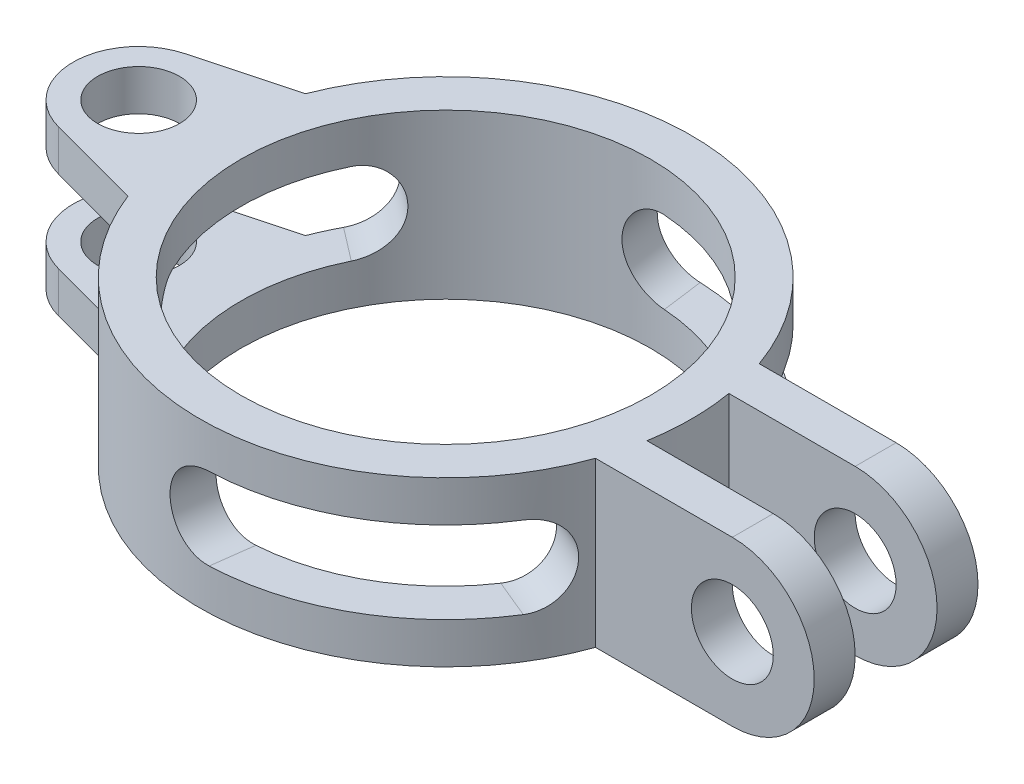
from build123d import *

# Parameters (mm, degrees)
SKETCH1_R           = 30
SKETCH1_R_2         = 25
BOSS_EXTRUDE1_DEPTH = 10
SKETCH3_R           = 5
BOSS_EXTRUDE2_DEPTH = 5
BOSS_EXTRUDE3_DEPTH = 20
CUT_EXTRUDE1_DEPTH  = 5
CUT_EXTRUDE2_REACH  = 70.739
FILLET1_R           = 5
FILLET2_R           = 5
FILLET3_R           = 5
FILLET4_R           = 5
FILLET5_R           = 5
FILLET6_R           = 5


# Some blends are built 0.0001 mm under size
with BuildPart() as part:
    # Sketch1 → Boss-Extrude1 (new, symmetric)
    with BuildSketch(Plane(origin=(0, 0, 0), x_dir=(1, 0, 0), z_dir=(0, 1, 0))):
        with Locations(Location((0, 0, 0), (0, 0, 270))):
            Circle(SKETCH1_R)
        with Locations(Location((0, 0, 0), (0, 0, 270))):
            Circle(SKETCH1_R_2, mode=Mode.SUBTRACT)
    extrude(amount=BOSS_EXTRUDE1_DEPTH, both=True)

    # Sketch3 → Boss-Extrude2 (add)
    with BuildSketch(Plane(origin=(0, 10, 0), x_dir=(1, 0, 0), z_dir=(0, 1, 0))):
        with BuildLine():
            Line((-27.975291142, 10.83434749), (-39.570552361, 7.72740661))
            ThreePointArc((-39.570552361, 7.72740661), (-45.5, 0), (-39.570552361, -7.72740661))
            Line((-39.570552361, -7.72740661), (-27.975291142, -10.83434749))
            ThreePointArc((-27.975291142, -10.83434749), (-30, 0), (-27.975291142, 10.83434749))
        make_face()
        with Locations(Location((-37.5, 0, 0), (0, 0, 270))):
            Circle(SKETCH3_R, mode=Mode.SUBTRACT)
    boss_extrude2 = extrude(amount=-BOSS_EXTRUDE2_DEPTH)

    # Sketch3<3> → Boss-Extrude3 (add)
    with BuildSketch(Plane(origin=(0, 10, 0), x_dir=(1, 0, 0), z_dir=(0, 1, 0))):
        with BuildLine():
            Line((55, 10), (28.284271247, 10))
            ThreePointArc((28.284271247, 10), (29.040144856, 7.527947046), (29.580398915, 5))
            Line((29.580398915, 5), (55, 5))
            Line((55, 5), (55, 10))
        make_face()
        with BuildLine():
            ThreePointArc((29.580398915, -5), (29.040144856, -7.527947046), (28.284271247, -10))
            Line((28.284271247, -10), (55, -10))
            Line((55, -10), (55, -5))
            Line((55, -5), (29.580398915, -5))
        make_face()
    extrude(amount=-BOSS_EXTRUDE3_DEPTH)

    # Mirror1: Boss-Extrude2 across plane
    add(boss_extrude2.mirror(Plane.ZX))

    # Sketch4 → Cut-Extrude1 (cut, symmetric)
    with BuildSketch(Plane(origin=(0, 0, 0), x_dir=(1, 0, 0), z_dir=(0, 1, 0))):
        with BuildLine():
            ThreePointArc((-19.833833507, 15.219035725), (-25, 0), (-19.833833507, -15.219035725))
            Line((-19.833833507, -15.219035725), (-23.800600209, -18.26284287))
            ThreePointArc((-23.800600209, -18.26284287), (-30, 0), (-23.800600209, 18.26284287))
            Line((-23.800600209, 18.26284287), (-19.833833507, 15.219035725))
        make_face()
        with BuildLine():
            Line((23.096988313, -9.567085809), (27.716385975, -11.480502971))
            ThreePointArc((27.716385975, -11.480502971), (15, -25.980762114), (-3.915785767, -29.743345841))
            Line((-3.915785767, -29.743345841), (-3.263154806, -24.786121534))
            ThreePointArc((-3.263154806, -24.786121534), (12.5, -21.650635095), (23.096988313, -9.567085809))
        make_face()
        with BuildLine():
            Line((-3.263154806, 24.786121534), (-3.915785767, 29.743345841))
            ThreePointArc((-3.915785767, 29.743345841), (15, 25.980762114), (27.716385975, 11.480502971))
            Line((27.716385975, 11.480502971), (23.096988313, 9.567085809))
            ThreePointArc((23.096988313, 9.567085809), (12.5, 21.650635095), (-3.263154806, 24.786121534))
        make_face()
    extrude(amount=CUT_EXTRUDE1_DEPTH, both=True, mode=Mode.SUBTRACT)

    # Cut-Extrude2: up to this face of the body (flat: up to its plane)
    cut_extrude2_end = Plane(part.part.faces().sort_by_distance((41.642135624, 0, -10))[0])
    # Sketch5 → Cut-Extrude2 (cut, up to the picked face)
    with BuildSketch(Plane.XY.offset(10), mode=Mode.PRIVATE) as cut_extrude2_sk1:
        with BuildLine():
            ThreePointArc((45, 10), (52.071067812, 7.071067812), (55, 0))
            Line((55, 0), (55, 10))
            Line((55, 10), (45, 10))
        make_face()
    cut_extrude2_tool1 = split(extrude(cut_extrude2_sk1.sketch, amount=-CUT_EXTRUDE2_REACH, mode=Mode.PRIVATE), bisect_by=cut_extrude2_end, keep=Keep.BOTH, mode=Mode.PRIVATE)
    # Sketch5 → Cut-Extrude2 (cut, up to the picked face)
    with BuildSketch(Plane.XY.offset(10), mode=Mode.PRIVATE) as cut_extrude2_sk2:
        with BuildLine():
            Line((55, -10), (55, 0))
            ThreePointArc((55, 0), (52.071067812, -7.071067812), (45, -10))
            Line((45, -10), (55, -10))
        make_face()
    cut_extrude2_tool2 = split(extrude(cut_extrude2_sk2.sketch, amount=-CUT_EXTRUDE2_REACH, mode=Mode.PRIVATE), bisect_by=cut_extrude2_end, keep=Keep.BOTH, mode=Mode.PRIVATE)
    # Sketch5 → Cut-Extrude2 (cut, up to the picked face)
    with BuildSketch(Plane.XY.offset(10), mode=Mode.PRIVATE) as cut_extrude2_sk3:
        with BuildLine():
            ThreePointArc((40, 0), (45, -5), (50, 0))
            Line((50, 0), (40, 0))
        make_face()
    cut_extrude2_tool3 = split(extrude(cut_extrude2_sk3.sketch, amount=-CUT_EXTRUDE2_REACH, mode=Mode.PRIVATE), bisect_by=cut_extrude2_end, keep=Keep.BOTH, mode=Mode.PRIVATE)
    # Sketch5 → Cut-Extrude2 (cut, up to the picked face)
    with BuildSketch(Plane.XY.offset(10), mode=Mode.PRIVATE) as cut_extrude2_sk4:
        with BuildLine():
            Line((40, 0), (50, 0))
            ThreePointArc((50, 0), (45, 5), (40, 0))
        make_face()
    cut_extrude2_tool4 = split(extrude(cut_extrude2_sk4.sketch, amount=-CUT_EXTRUDE2_REACH, mode=Mode.PRIVATE), bisect_by=cut_extrude2_end, keep=Keep.BOTH, mode=Mode.PRIVATE)
    # Sketch5 → Cut-Extrude2 (cut, up to the picked face)
    with BuildSketch(Plane.XY.offset(10), mode=Mode.PRIVATE) as cut_extrude2_sk5:
        with BuildLine():
            ThreePointArc((40, 0), (45, -5), (50, 0))
            Line((50, 0), (40, 0))
        make_face()
    cut_extrude2_tool5 = split(extrude(cut_extrude2_sk5.sketch, amount=-CUT_EXTRUDE2_REACH, mode=Mode.PRIVATE), bisect_by=cut_extrude2_end, keep=Keep.BOTH, mode=Mode.PRIVATE)
    # Sketch5 → Cut-Extrude2 (cut, up to the picked face)
    with BuildSketch(Plane.XY.offset(10), mode=Mode.PRIVATE) as cut_extrude2_sk6:
        with BuildLine():
            Line((40, 0), (50, 0))
            ThreePointArc((50, 0), (45, 5), (40, 0))
        make_face()
    cut_extrude2_tool6 = split(extrude(cut_extrude2_sk6.sketch, amount=-CUT_EXTRUDE2_REACH, mode=Mode.PRIVATE), bisect_by=cut_extrude2_end, keep=Keep.BOTH, mode=Mode.PRIVATE)
    add(cut_extrude2_tool1.solids().sort_by(Axis((52.766321, 7.766321, 10), (0, 0, -1)))[0], mode=Mode.SUBTRACT)
    add(cut_extrude2_tool2.solids().sort_by(Axis((52.766321, -7.766321, 10), (0, 0, -1)))[0], mode=Mode.SUBTRACT)
    add(cut_extrude2_tool3.solids().sort_by(Axis((45, -2.122066, 10), (0, 0, -1)))[0], mode=Mode.SUBTRACT)
    add(cut_extrude2_tool4.solids().sort_by(Axis((45, 2.122066, 10), (0, 0, -1)))[0], mode=Mode.SUBTRACT)
    add(cut_extrude2_tool5.solids().sort_by(Axis((45, -2.122066, 10), (0, 0, -1)))[0], mode=Mode.SUBTRACT)
    add(cut_extrude2_tool6.solids().sort_by(Axis((45, 2.122066, 10), (0, 0, -1)))[0], mode=Mode.SUBTRACT)

    # Fillet1
    # the kernel refuses this fillet: 5 mm, written as the material it adds along each edge
    with BuildSketch(Plane(origin=(-5.547363169, -5, 42.136406608), x_dir=(0, 1, 0), z_dir=(0.13052619222004758, 0, -0.9914448613738109))) as fillet1_piece_1_section:
        with BuildLine():
            CenterArc((FILLET1_R, FILLET1_R), FILLET1_R, 180, 90)
            Line((0, FILLET1_R), (0, 0))
            Line((0, 0), (FILLET1_R, 0))
        make_face()
    fillet1_piece_1 = extrude(amount=30, mode=Mode.PRIVATE)
    fillet1_piece_1 = fillet1_piece_1 - Plane(origin=(0, -3.86938401, 0), x_dir=(0, 0, 1), z_dir=(0, -1, 0)) * Cylinder(25, 80, mode=Mode.PRIVATE)
    fillet1_piece_1 = fillet1_piece_1 & Plane(origin=(0, -3.86938401, 0), x_dir=(0, 0, 1), z_dir=(0, 1, 0)) * Cylinder(30, 80, mode=Mode.PRIVATE)
    add(fillet1_piece_1)
    with BuildSketch(Plane(origin=(-5.547363169, 5, 42.136406608), x_dir=(0, -1, 0), z_dir=(0.13052619222004758, 0, -0.9914448613738109))) as fillet1_piece_2_section:
        with BuildLine():
            CenterArc((FILLET1_R, -FILLET1_R), FILLET1_R, 90, 90)
            Line((0, -FILLET1_R), (0, 0))
            Line((0, 0), (FILLET1_R, 0))
        make_face()
    fillet1_piece_2 = extrude(amount=30, mode=Mode.PRIVATE)
    fillet1_piece_2 = fillet1_piece_2 - Plane(origin=(0, 3.86938401, 0), x_dir=(0, 0, 1), z_dir=(0, -1, 0)) * Cylinder(25, 80, mode=Mode.PRIVATE)
    fillet1_piece_2 = fillet1_piece_2 & Plane(origin=(0, 3.86938401, 0), x_dir=(0, 0, 1), z_dir=(0, 1, 0)) * Cylinder(30, 80, mode=Mode.PRIVATE)
    add(fillet1_piece_2)

    # Fillet2
    fillet2_edges = [part.edges().sort_by_distance(p)[0] for p in [
        (25.406687144, 5, 10.52379439),
        (25.406687144, -5, 10.52379439),
    ]]
    fillet(fillet2_edges, radius=FILLET2_R - 0.0001)  # a hair under: the kernel refuses the full size

    # Fillet3
    fillet3_edges = [part.edges().sort_by_distance(p)[0] for p in [
        (25.406687144, -5, -10.52379439),
        (25.406687144, 5, -10.52379439),
    ]]
    fillet(fillet3_edges, radius=FILLET3_R - 0.0001)  # a hair under: the kernel refuses the full size

    # Fillet4
    fillet4_edges = [part.edges().sort_by_distance(p)[0] for p in [
        (-3.589470286, 5, -27.264733688),
        (-3.589470286, -5, -27.264733688),
    ]]
    fillet(fillet4_edges, radius=FILLET4_R - 0.0001)  # a hair under: the kernel refuses the full size

    # Fillet5
    fillet5_edges = [part.edges().sort_by_distance(p)[0] for p in [
        (-21.817216858, -5, -16.740939298),
        (-21.817216858, 5, -16.740939298),
    ]]
    fillet(fillet5_edges, radius=FILLET5_R - 0.0001)  # a hair under: the kernel refuses the full size

    # Fillet6
    fillet6_edges = [part.edges().sort_by_distance(p)[0] for p in [
        (-21.817216858, 5, 16.740939298),
        (-21.817216858, -5, 16.740939298),
    ]]
    fillet(fillet6_edges, radius=FILLET6_R - 0.0001)  # a hair under: the kernel refuses the full size


solid = part.part
